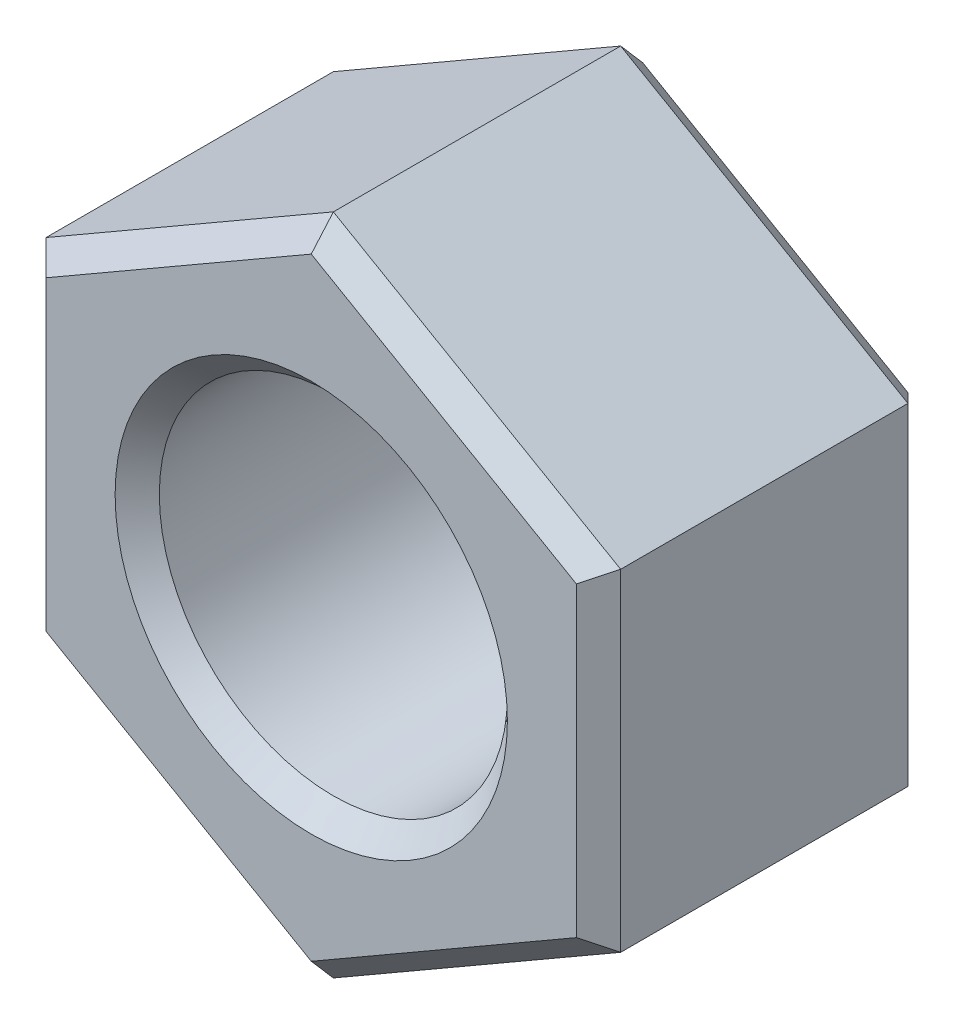
from build123d import *

# Parameters (mm, degrees)
SKETCH1_R           = 1.575
BOSS_EXTRUDE1_DEPTH = 1.5
DEBURS_SIZE         = 0.2


with BuildPart() as part:
    # Sketch1 → Boss-Extrude1 (new, symmetric)
    with BuildSketch(Plane.XY):
        Polygon((2.6, -1.5011107), (2.6, 1.5011107), (0, 3.0022214), (-2.6, 1.5011107), (-2.6, -1.5011107), (0, -3.0022214), align=None)
        Circle(SKETCH1_R, mode=Mode.SUBTRACT)
    extrude(amount=BOSS_EXTRUDE1_DEPTH, both=True)

    # Deburs
    deburs_edges = [part.edges().sort_by_distance(p)[0] for p in [
        (-1.575, 0, -1.5),
        (2.6, 0, -1.5),
        (1.3, 2.25166605, -1.5),
        (-1.3, 2.25166605, -1.5),
        (-2.6, 0, -1.5),
        (-1.3, -2.25166605, -1.5),
        (1.3, -2.25166605, -1.5),
        (-1.575, 0, 1.5),
        (-1.3, -2.25166605, 1.5),
        (-2.6, 0, 1.5),
        (-1.3, 2.25166605, 1.5),
        (1.3, 2.25166605, 1.5),
        (2.6, 0, 1.5),
        (1.3, -2.25166605, 1.5),
    ]]
    chamfer(deburs_edges, length=DEBURS_SIZE)


solid = part.part
